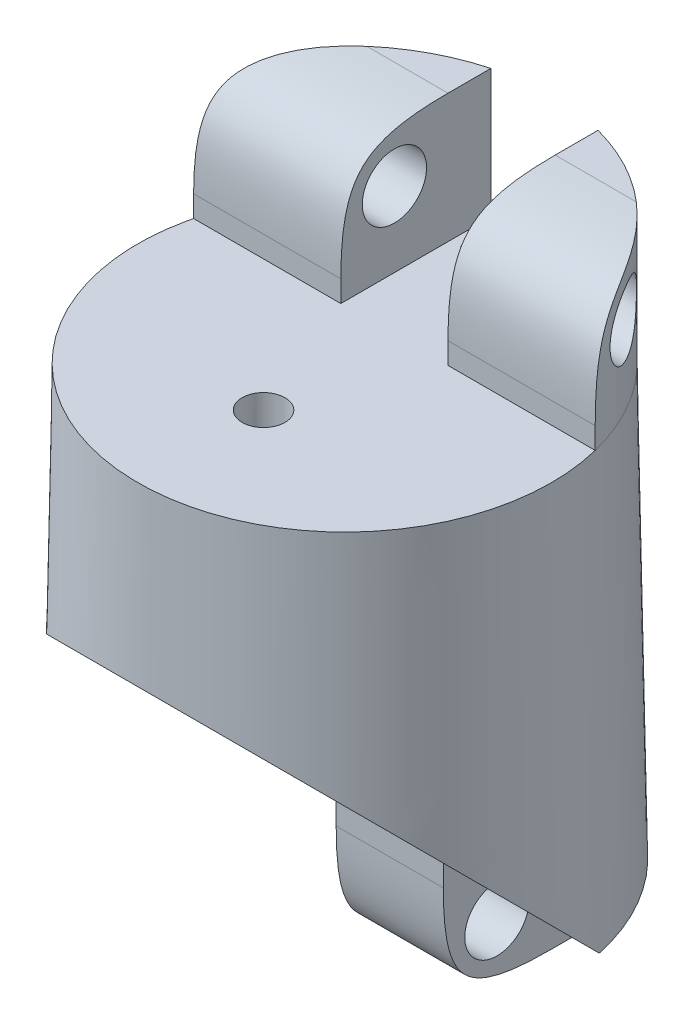
from build123d import *

# Parameters (mm, degrees)
SKETCH1_R                     = 10
BOSS_EXTRUDE1_DEPTH           = 20
BOSS_EXTRUDE1_TAPER           = 1
BOSS_EXTRUDE1_OTHER_WAY_DEPTH = 6
BOSS_EXTRUDE1_OTHER_WAY_TAPER = -1
CUT_EXTRUDE1_DEPTH            = 25.580706916
CUT_EXTRUDE1_DEPTH_BACK       = 25.580706916
SKETCH3_W                     = 8.405788387
SKETCH3_H                     = 6
SKETCH3_W_2                   = 8.899014998
CUT_EXTRUDE2_DEPTH            = 26.314759228
SKETCH4_R                     = 1.5
CUT_EXTRUDE3_DEPTH            = 20
FILLET1_SIZE                  = 5
BOSS_EXTRUDE2_DEPTH           = 6
CUT_EXTRUDE4_DEPTH            = 31.552844708
CUT_EXTRUDE4_DEPTH_BACK       = 31.552844708
SKETCH6_R                     = 1.5
FILLET2_SIZE                  = 5
SKETCH7_R                     = 1
CUT_EXTRUDE5_DEPTH            = 30.62097947
CUT_EXTRUDE6_DEPTH            = 30.62097947


with BuildPart() as part:
    # Sketch1 → Boss-Extrude1 (new body)
    with BuildSketch(Plane(origin=(0, 0, 0), x_dir=(1, 0, 0), z_dir=(0, 1, 0))):
        Circle(SKETCH1_R)
    extrude(amount=BOSS_EXTRUDE1_DEPTH, taper=BOSS_EXTRUDE1_TAPER)

    # Sketch1 → Boss-Extrude1 other way (add)
    with BuildSketch(Plane(origin=(0, 0, 0), x_dir=(1, 0, 0), z_dir=(0, 1, 0))):
        Circle(SKETCH1_R)
    extrude(amount=-BOSS_EXTRUDE1_OTHER_WAY_DEPTH, taper=BOSS_EXTRUDE1_OTHER_WAY_TAPER)

    # Sketch2 → Cut-Extrude1 (cut, two sides: drawn at the far end of the back side and taken through both)
    with BuildSketch(Plane(origin=(0, 0, 0), x_dir=(0, 0, -1), z_dir=(1, 0, 0)).offset(-CUT_EXTRUDE1_DEPTH_BACK)):
        Polygon((2.10473039, -6), (2.10473039, 0), (-12.119911375, 14.224641764), (-12.119911375, -6), align=None)
    extrude(amount=CUT_EXTRUDE1_DEPTH + CUT_EXTRUDE1_DEPTH_BACK, mode=Mode.SUBTRACT)

    # Sketch3 → Cut-Extrude2 (cut, through all)
    with BuildSketch(Plane.XY.offset(-2.10473039)):
        with Locations((-6.702894194, -3)):
            Rectangle(SKETCH3_W, SKETCH3_H)
        with Locations((6.949507499, -3)):
            Rectangle(SKETCH3_W_2, SKETCH3_H)
    extrude(amount=-CUT_EXTRUDE2_DEPTH, mode=Mode.SUBTRACT)

    # Sketch4 → Cut-Extrude3 (cut)
    with BuildSketch(Plane(origin=(2.5, 0, 0), x_dir=(0, 0, -1), z_dir=(1, 0, 0))):
        with Locations(Location((4.60473039, -3.5, 0), (0, 0, 90))):
            Circle(SKETCH4_R)
    extrude(amount=-CUT_EXTRUDE3_DEPTH, mode=Mode.SUBTRACT)

    # Fillet1
    # a fillet whose section is not a circle: 5 mm, written as the material it takes off along each edge
    with BuildSketch(Plane(origin=(15, -6, -2.10473039), x_dir=(0, 0, -1), z_dir=(-1, 0, 0))) as fillet1_piece_1:
        with BuildLine():
            Bezier((FILLET1_SIZE, 0), (0, 0), (0, -FILLET1_SIZE), weights=[1, 1.5, 1])
            Line((0, -FILLET1_SIZE), (0, 0))
            Line((0, 0), (FILLET1_SIZE, 0))
        make_face()
    extrude(amount=30, mode=Mode.SUBTRACT)

    # Sketch5 → Boss-Extrude2 (add)
    with BuildSketch(Plane(origin=(0, 20, 0), x_dir=(1, 0, 0), z_dir=(0, 1, 0))):
        with BuildLine():
            Line((-2.5, 2.321472295), (-2.5, 9.321472295))
            ThreePointArc((-2.5, 9.321472295), (-6.889090297, 6.75871886), (-9.367529671, 2.321472295))
            Line((-9.367529671, 2.321472295), (-2.5, 2.321472295))
        make_face()
        with BuildLine():
            ThreePointArc((9.367529671, 2.321472295), (6.889090297, 6.75871886), (2.5, 9.321472295))
            Line((2.5, 9.321472295), (2.5, 2.321472295))
            Line((2.5, 2.321472295), (9.367529671, 2.321472295))
        make_face()
    extrude(amount=BOSS_EXTRUDE2_DEPTH)

    # Sketch6 → Cut-Extrude4 (cut, two sides: drawn at the far end of the back side and taken through both)
    with BuildSketch(Plane.ZY.offset(-2.5).offset(-CUT_EXTRUDE4_DEPTH_BACK)):
        with Locations((-4.821472295, 23.5)):
            Circle(SKETCH6_R)
    extrude(amount=CUT_EXTRUDE4_DEPTH + CUT_EXTRUDE4_DEPTH_BACK, mode=Mode.SUBTRACT)

    # Fillet2
    # a fillet whose section is not a circle: 5 mm, written as the material it takes off along each edge
    with BuildSketch(Plane(origin=(-10, 26, -2.321472295), x_dir=(0, -1, 0), z_dir=(1, 0, 0)), Plane(origin=(-21.867529671, 26, -2.321472295), x_dir=(0, -1, 0), z_dir=(1, 0, 0))) as fillet2_piece_1:
        with BuildLine():
            Bezier((FILLET2_SIZE, 0), (0, 0), (0, FILLET2_SIZE), weights=[1, 1.5, 1])
            Line((0, FILLET2_SIZE), (0, 0))
            Line((0, 0), (FILLET2_SIZE, 0))
        make_face()
    extrude(amount=31.867529671, mode=Mode.SUBTRACT)

    # Sketch7 → Cut-Extrude5 (cut, through all)
    with BuildSketch(Plane(origin=(0, 20, 0), x_dir=(1, 0, 0), z_dir=(0, 1, 0))):
        with Locations(Location((0, -3.783258095, 0), (0, 0, 270))):
            Circle(SKETCH7_R)
    extrude(amount=-CUT_EXTRUDE5_DEPTH, mode=Mode.SUBTRACT)

    # Sketch8 → Cut-Extrude6 (cut, through all)
    with BuildSketch(Plane(origin=(0, 20, 0), x_dir=(1, 0, 0), z_dir=(0, 1, 0))):
        with BuildLine():
            Line((2, 7.402414096), (2, 8.929666682))
            ThreePointArc((2, 8.929666682), (0, 9.150898701), (-2, 8.929666682))
            Line((-2, 8.929666682), (-2, 7.402414096))
            Line((-2, 7.402414096), (2, 7.402414096))
        make_face()
    extrude(amount=-CUT_EXTRUDE6_DEPTH, mode=Mode.SUBTRACT)


solid = part.part
